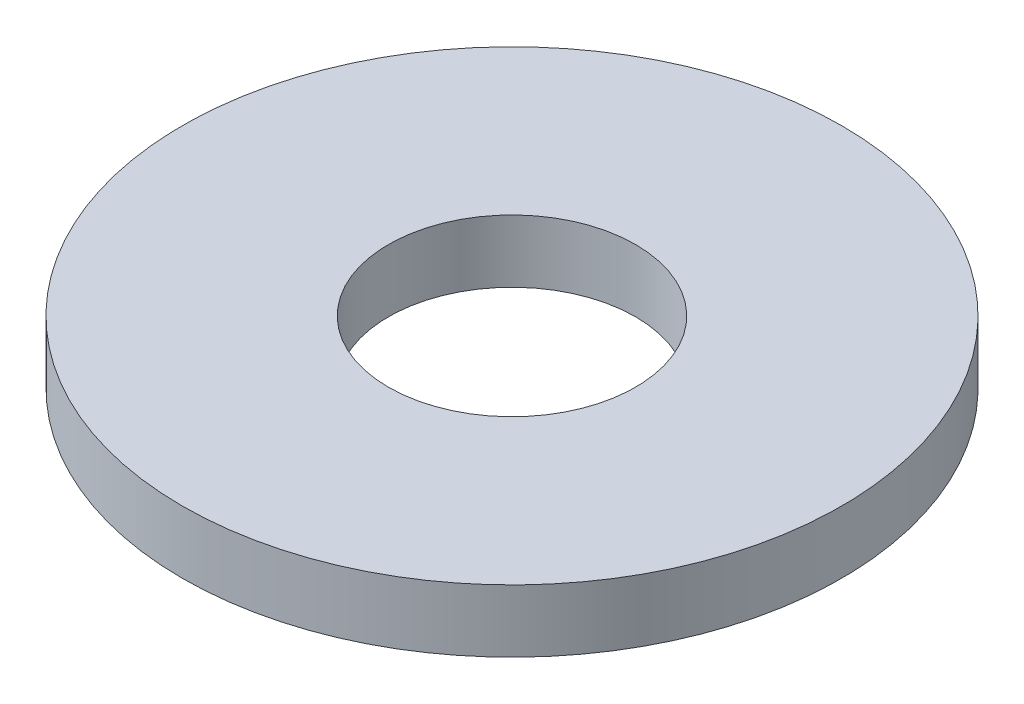
from build123d import *

# Parameters (mm, degrees)
SKETCH1_R           = 100
BOSS_EXTRUDE1_DEPTH = 19
SKETCH2_R           = 37.5
CUT_EXTRUDE1_DEPTH  = 143.691975948


with BuildPart() as part:
    # Sketch1 → Boss-Extrude1 (new body)
    with BuildSketch(Plane(origin=(0, 0, 0), x_dir=(1, 0, 0), z_dir=(0, 1, 0))):
        Circle(SKETCH1_R)
    extrude(amount=BOSS_EXTRUDE1_DEPTH)

    # Sketch2 → Cut-Extrude1 (cut, through all)
    with BuildSketch(Plane(origin=(0, 0, 0), x_dir=(1, 0, 0), z_dir=(0, 1, 0))):
        Circle(SKETCH2_R)
    extrude(amount=CUT_EXTRUDE1_DEPTH, mode=Mode.SUBTRACT)


solid = part.part
